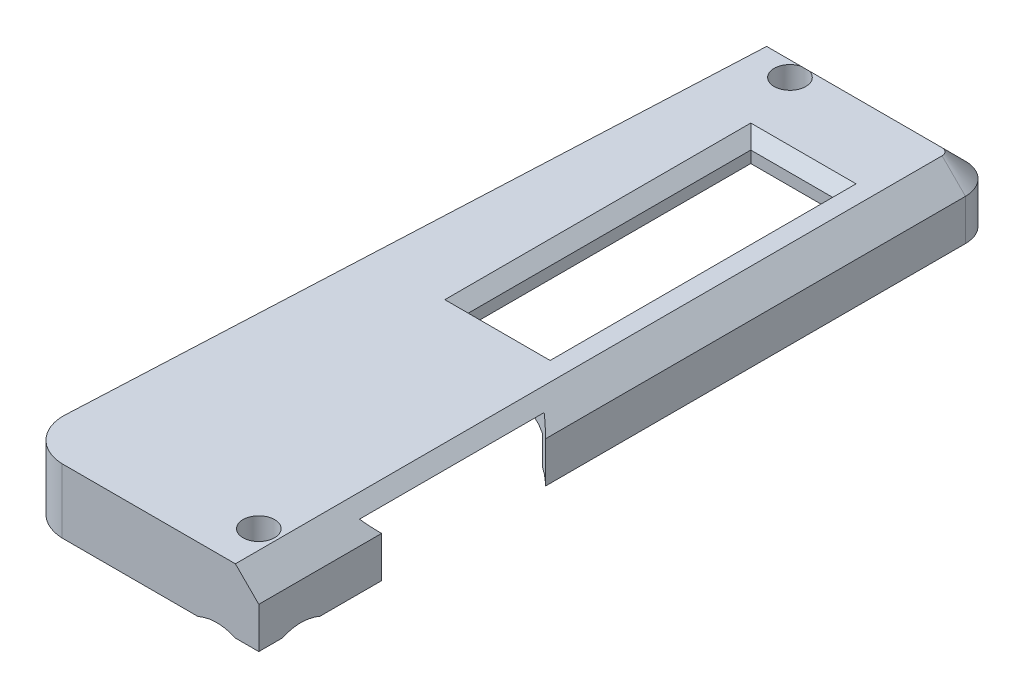
from build123d import *

# Parameters (mm, degrees)
SKETCH_1_R                      = 1.35
EXTRUDE_1_DEPTH                 = 2
EXTRUDE_2_DEPTH                 = 2
CUT_EXTRUDE_1_DEPTH             = 62.421331799
CUT_EXTRUDE_1_DEPTH_BACK        = 62.421331799
EXTRUDE_START                   = 3.5
EXTRUDE_3_DEPTH                 = 3.5
SKETCH_5_W                      = 14
SKETCH_5_H                      = 4.5
CUT_EXTRUDE_2_DEPTH             = 9
CUT_EXTRUDE_3_REACH             = 63.635
SKETCH_7_W                      = 7
SKETCH_7_H                      = 24
CUT_EXTRUDE_4_DEPTH             = 62.488454201
EXTRUDE_4_DEPTH                 = 3
EXTRUDE_START_2                 = 3
EXTRUDE_5_DEPTH                 = 3
CHAMFER_2_SIZE                  = 1.5
EXTRUDE_6_DEPTH                 = 1
EXTRUDE_START_3                 = 1
EXTRUDE_7_DEPTH                 = 1
CHAMFER_3_SIZE                  = 1.2
CUT_EXTRUDE_6_REACH             = 63.635
SKETCH_13_W                     = 7
SKETCH_13_H                     = 0.9
CUT_EXTRUDE_6_DIRECTION_2_DEPTH = 62.634649346
SKETCH_14_W                     = 7
SKETCH_14_H                     = 0.75
EXTRUDE_8_DEPTH                 = 2
CHAMFER_1_SIZE                  = 1
SKETCH_15_W                     = 2.625664416
SKETCH_15_H                     = 11
CUT_EXTRUDE_7_DEPTH             = 2.7
CUT_EXTRUDE_START               = -3
SKETCH_16_W                     = 0.55
SKETCH_16_H                     = 2.6
CUT_EXTRUDE_8_DEPTH             = 3
SKETCH_17_W                     = 0.7
SKETCH_17_H                     = 4
CUT_EXTRUDE_9_DEPTH             = 2
SKETCH_18_W                     = 2
SKETCH_18_H                     = 36.2
EXTRUDE_9_DEPTH                 = 2
EXTRUDE_START_4                 = 2
EXTRUDE_10_DEPTH                = 2
SKETCH_20_W                     = 4.68689843
SKETCH_20_H                     = 2
EXTRUDE_11_DEPTH                = 2
SKETCH_21_W                     = 1.738825119
SKETCH_21_H                     = 2
EXTRUDE_12_DEPTH                = 1
CUT_EXTRUDE_10_DEPTH            = 29.7
CHAMFER_4_SIZE                  = 2


with BuildPart() as part:
    # 草图1 → 凸台-拉伸1 (new body)
    with BuildSketch(Plane(origin=(0, 0, 0), x_dir=(1, 0, 0), z_dir=(0, 1, 0))):
        with BuildLine():
            Line((0, 3.3), (11.7, 3.3))
            ThreePointArc((11.7, 3.3), (13.538477631, 2.538477631), (14.3, 0.7))
            Line((14.3, 0.7), (14.3, -59.7))
            Line((14.3, -59.7), (-3.3, -59.7))
            Line((-3.3, -59.7), (-3.3, 0))
            Line((-3.3, 0), (-3.3, 3.3))
            Line((-3.3, 3.3), (0, 3.3))
        make_face()
        with Locations(Location((0, 0, 0), (0, 0, 270))):
            Circle(SKETCH_1_R, mode=Mode.SUBTRACT)
        with Locations(Location((10.7, -56.1, 0), (0, 0, 270))):
            Circle(SKETCH_1_R, mode=Mode.SUBTRACT)
    extrude(amount=EXTRUDE_1_DEPTH)

    # 草图2 → 凸台-拉伸2 (add)
    with BuildSketch(Plane(origin=(0, 2, 0), x_dir=(1, 0, 0), z_dir=(0, 1, 0))):
        Polygon((-3.3, 1.179910787), (-6.171573065, -59.7), (-3.3, -59.7), align=None)
    extrude(amount=-EXTRUDE_2_DEPTH)

    # 草图3 → 切除-拉伸1 (cut, two sides: drawn at the far end of the back side and taken through both)
    with BuildSketch(Plane(origin=(0, 2, 0), x_dir=(1, 0, 0), z_dir=(0, 1, 0)).offset(-CUT_EXTRUDE_1_DEPTH_BACK)):
        Polygon((-3.3, 3.3), (-3.3, 1.179910787), (-3.2, 3.3), align=None)
        with BuildLine():
            ThreePointArc((-2.499988961, -59.7), (-4.984483511, -58.608076588), (-6.001389, -56.091946))
            Line((-6.001389, -56.091946), (-6.171573065, -59.7))
            Line((-6.171573065, -59.7), (-2.499988961, -59.7))
        make_face()
    extrude(amount=CUT_EXTRUDE_1_DEPTH + CUT_EXTRUDE_1_DEPTH_BACK, mode=Mode.SUBTRACT)

    # 草图4 → 凸台-拉伸3 (add)
    with BuildSketch(Plane.XZ.offset(EXTRUDE_START)):
        with BuildLine():
            Line((-6.001389, 56.091946), (-3.2, -3.3))
            Line((-3.2, -3.3), (11.7, -3.3))
            ThreePointArc((11.7, -3.3), (13.538477631, -2.538477631), (14.3, -0.7))
            Line((14.3, -0.7), (14.3, 59.7))
            Line((14.3, 59.7), (-2.499988961, 59.7))
            ThreePointArc((-2.499988961, 59.7), (-4.984483511, 58.608076588), (-6.001389, 56.091946))
        make_face()
        with BuildLine():
            Line((12.8, -0.7), (12.8, 54.32447191))
            ThreePointArc((12.8, 54.32447191), (12.644543648, 58.044543648), (8.92447191, 58.2))
            Line((8.92447191, 58.2), (-2.476371899, 58.2))
            ThreePointArc((-2.476371899, 58.2), (-3.904150356, 57.567435732), (-4.501255338, 56.124468472))
            Line((-4.501255338, 56.124468472), (-1.945653662, 1.943433001))
            ThreePointArc((-1.945653662, 1.943433001), (-1.872904729, -2.013635488), (2.079062289, -1.8))
            Line((2.079062289, -1.8), (11.7, -1.8))
            ThreePointArc((11.7, -1.8), (12.477817459, -1.477817459), (12.8, -0.7))
        make_face(mode=Mode.SUBTRACT)
    extrude(amount=-EXTRUDE_3_DEPTH)

    # 草图5 → 切除-拉伸2 (cut)
    with BuildSketch(Plane(origin=(14.3, 0, 0), x_dir=(0, 0, -1), z_dir=(1, 0, 0))):
        with Locations((-42.2, -1.25)):
            Rectangle(SKETCH_5_W, SKETCH_5_H)
    extrude(amount=-CUT_EXTRUDE_2_DEPTH, mode=Mode.SUBTRACT)

    # 切除-拉伸3: up to this face of the body (flat: up to its plane)
    cut_extrude_3_end = Plane(part.part.faces().sort_by_distance((9.8, 1, 42.2))[0])
    # 草图6 → 切除-拉伸3 (cut, up to the picked face)
    with BuildSketch(Plane.XZ.offset(3.5), mode=Mode.PRIVATE) as cut_extrude_3_sk1:
        with BuildLine():
            Line((2.158571571, 33.539745962), (2.158571571, 50.860254038))
            ThreePointArc((2.158571571, 50.860254038), (17.158571571, 42.2), (2.158571571, 33.539745962))
        make_face()
    cut_extrude_3_tool1 = split(extrude(cut_extrude_3_sk1.sketch, amount=-CUT_EXTRUDE_3_REACH, mode=Mode.PRIVATE), bisect_by=cut_extrude_3_end, keep=Keep.BOTH, mode=Mode.PRIVATE)
    add(cut_extrude_3_tool1.solids().sort_by(Axis((8.87184, -3.5, 42.2), (0, 1, 0)))[0], mode=Mode.SUBTRACT)

    # 草图7 → 切除-拉伸4 (cut, through all)
    with BuildSketch(Plane.XZ):
        with Locations((6.2, 17.3)):
            Rectangle(SKETCH_7_W, SKETCH_7_H)
    extrude(amount=-CUT_EXTRUDE_4_DEPTH, mode=Mode.SUBTRACT)

    # 草图8 → 凸台-拉伸4 (add)
    with BuildSketch(Plane.XZ):
        Polygon((-2.891678333, 22), (0.3, 22), (0.3, 18), (-2.703007027, 18), align=None)
        Polygon((-2.514335721, 14), (0.3, 14), (0.3, 10), (-2.325664416, 10), align=None)
    extrude(amount=EXTRUDE_4_DEPTH)

    # 草图9 → 凸台-拉伸5 (add)
    with BuildSketch(Plane.XZ.offset(EXTRUDE_START_2)):
        with BuildLine():
            Line((2.75, 0), (2.75, 2.6))
            Line((2.75, 2.6), (3.3, 2.6))
            Line((3.3, 2.6), (3.3, -1.8))
            Line((3.3, -1.8), (2.079062289, -1.8))
            ThreePointArc((2.079062289, -1.8), (2.576812109, -0.960489122), (2.75, 0))
        make_face()
    extrude(amount=-EXTRUDE_5_DEPTH)

    # 倒角2
    chamfer_2_edges = [part.edges().sort_by_distance(p)[0] for p in [
        (0.3, -3, 20),
        (0.3, -3, 12),
        (3.025, -3, 2.6),
    ]]
    chamfer(chamfer_2_edges, length=CHAMFER_2_SIZE)

    # 草图10 → 凸台-拉伸6 (add)
    with BuildSketch(Plane.XZ):
        Polygon((0.3, 22), (0.3, 31.6), (-3.344489466, 31.6), (-2.891678333, 22), align=None)
        Polygon((0.3, 18), (0.3, 14), (-2.514335721, 14), (-2.703007027, 18), align=None)
    extrude(amount=EXTRUDE_6_DEPTH)

    # 草图11 → 凸台-拉伸7 (add)
    with BuildSketch(Plane.XZ.offset(EXTRUDE_START_3)):
        with BuildLine():
            Line((0.3, 31.6), (12.8, 31.6))
            Line((12.8, 31.6), (12.8, 33.943227914))
            ThreePointArc((12.8, 33.943227914), (7.537460775, 32.207180429), (2.158571571, 33.539745962))
            Line((2.158571571, 33.539745962), (2.158571571, 33.6))
            Line((2.158571571, 33.6), (-3.438825119, 33.6))
            Line((-3.438825119, 33.6), (-3.344489466, 31.6))
            Line((-3.344489466, 31.6), (0.3, 31.6))
        make_face()
    extrude(amount=-EXTRUDE_7_DEPTH)

    # 倒角3
    # the kernel refuses this chamfer: 1.2 mm, written as the material it takes off along each edge
    with BuildSketch(Plane(origin=(10.7, -3.5, 56.1), x_dir=(-0.25212926598993896, 0, -0.9676935637025672), z_dir=(-0.9676935637025672, 0, 0.25212926598993896))) as chamfer_3_piece_1:
        Polygon((2.75, -CHAMFER_3_SIZE), (2.75 + CHAMFER_3_SIZE, 0), (2.75, 0), align=None)
    revolve(axis=Axis((10.7, -3.5, 56.1), (0, -1, 0)), revolution_arc=299.20709405, mode=Mode.SUBTRACT)
    with BuildSketch(Plane(origin=(0, -3.5, 0), x_dir=(0.3317021922572173, 0, 0.9433841506256908), z_dir=(0.9433841506256908, 0, -0.3317021922572173))) as chamfer_3_piece_2_section:
        Polygon((2.75, -CHAMFER_3_SIZE), (2.75 + CHAMFER_3_SIZE, 0), (2.75, 0), align=None)
    chamfer_3_piece_2 = revolve(axis=Axis((0, -3.5, 0), (0, -1, 0)), revolution_arc=312.891771357, mode=Mode.PRIVATE)
    chamfer_3_piece_2 = split(chamfer_3_piece_2, bisect_by=Plane(origin=(2.75, -2.813189382, 1.829031727), z_dir=(-1, 0, 0)), keep=Keep.TOP, mode=Mode.PRIVATE)
    add(chamfer_3_piece_2, mode=Mode.SUBTRACT)
    with BuildSketch(Plane(origin=(0, -3.5, 0), x_dir=(0.3317021922572173, 0, 0.9433841506256908), z_dir=(0.9433841506256908, 0, -0.3317021922572173))) as chamfer_3_piece_3_section:
        Polygon((2.75, -CHAMFER_3_SIZE), (2.75 + CHAMFER_3_SIZE, 0), (2.75, 0), align=None)
    chamfer_3_piece_3 = revolve(axis=Axis((0, -3.5, 0), (0, -1, 0)), revolution_arc=312.891771357, mode=Mode.PRIVATE)
    chamfer_3_piece_3 = split(chamfer_3_piece_3, bisect_by=Plane(origin=(2.94239335, -3, -2.084958932), z_dir=(0, -1, 0)), keep=Keep.TOP, mode=Mode.PRIVATE)
    add(chamfer_3_piece_3, mode=Mode.SUBTRACT)

    # 草图13 → 切除-拉伸6 (cut, up to next)
    with BuildSketch(Plane(origin=(0, 2, 0), x_dir=(1, 0, 0), z_dir=(0, 1, 0)), mode=Mode.PRIVATE) as cut_extrude_6_sk1:
        with Locations((6.2, -29.75)):
            Rectangle(SKETCH_13_W, SKETCH_13_H)
    cut_extrude_6_tool1 = extrude(cut_extrude_6_sk1.sketch, amount=-CUT_EXTRUDE_6_REACH, mode=Mode.PRIVATE) & part.part
    add(cut_extrude_6_tool1.solids().sort_by_distance((6.2, 2, 29.75))[0], mode=Mode.SUBTRACT)

    # 草图13 → 切除-拉伸6 direction 2 (cut)
    with BuildSketch(Plane(origin=(0, 2, 0), x_dir=(1, 0, 0), z_dir=(0, 1, 0))):
        with Locations((6.2, -29.75)):
            Rectangle(SKETCH_13_W, SKETCH_13_H)
    extrude(amount=CUT_EXTRUDE_6_DIRECTION_2_DEPTH, mode=Mode.SUBTRACT)

    # 草图14 → 凸台-拉伸8 (add)
    with BuildSketch(Plane(origin=(0, 2, 0), x_dir=(1, 0, 0), z_dir=(0, 1, 0))):
        with Locations((6.2, -5.675)):
            Rectangle(SKETCH_14_W, SKETCH_14_H)
    extrude(amount=-EXTRUDE_8_DEPTH)

    # 倒角1
    chamfer_1_edges = [part.edges().sort_by_distance(p)[0] for p in [
        (2.7, 2, 18.125),
        (6.2, 2, 30.2),
        (9.7, 2, 18.125),
        (6.2, 2, 6.05),
    ]]
    chamfer(chamfer_1_edges, length=CHAMFER_1_SIZE)

    # 草图15 → 切除-拉伸7 (cut)
    with BuildSketch(Plane.XZ.offset(3)):
        with Locations((-1.012832208, 15.5)):
            Rectangle(SKETCH_15_W, SKETCH_15_H)
    extrude(amount=-CUT_EXTRUDE_7_DEPTH, mode=Mode.SUBTRACT)

    # 草图16 → 切除-拉伸8 (cut)
    with BuildSketch(Plane.XZ.offset(3).offset(CUT_EXTRUDE_START)):
        with Locations((3.025, 1.3)):
            Rectangle(SKETCH_16_W, SKETCH_16_H)
    extrude(amount=CUT_EXTRUDE_8_DEPTH, mode=Mode.SUBTRACT)

    # 草图17 → 切除-拉伸9 (cut)
    with BuildSketch(Plane.XZ.offset(3.5)):
        with Locations((13.15, 4.5)):
            Rectangle(SKETCH_17_W, SKETCH_17_H)
    extrude(amount=-CUT_EXTRUDE_9_DEPTH, mode=Mode.SUBTRACT)

    # 草图18 → 凸台-拉伸9 (add)
    with BuildSketch(Plane.XZ):
        with Locations((-0.7, 40.1)):
            Rectangle(SKETCH_18_W, SKETCH_18_H)
    extrude(amount=EXTRUDE_9_DEPTH)

    # 草图19 → 凸台-拉伸10 (add)
    with BuildSketch(Plane.XZ.offset(EXTRUDE_START_4)):
        with BuildLine():
            Line((9.357427842, 53.7), (0.3, 53.7))
            Line((0.3, 53.7), (0.3, 51.7))
            Line((0.3, 51.7), (4.036072572, 51.7))
            ThreePointArc((4.036072572, 51.7), (8.563084042, 52.100875957), (12.8, 50.456772086))
            Line((12.8, 50.456772086), (12.8, 54.32447191))
            ThreePointArc((12.8, 54.32447191), (11.190831463, 53.394157345), (9.357427842, 53.7))
        make_face()
    extrude(amount=-EXTRUDE_10_DEPTH)

    # 草图20 → 凸台-拉伸11 (add)
    with BuildSketch(Plane.XZ):
        with Locations((-2.043449215, 52.7)):
            Rectangle(SKETCH_20_W, SKETCH_20_H)
    extrude(amount=EXTRUDE_11_DEPTH)

    # 草图21 → 凸台-拉伸12 (add)
    with BuildSketch(Plane.XZ.offset(1)):
        with Locations((-2.569412559, 32.6)):
            Rectangle(SKETCH_21_W, SKETCH_21_H)
    extrude(amount=EXTRUDE_12_DEPTH)

    # 草图22 → 切除-拉伸10 (cut)
    with BuildSketch(Plane(origin=(0, 0, 22), x_dir=(-1, 0, 0), z_dir=(0, 0, -1))):
        Polygon((0.2, -2), (-0.3, -1.5), (-0.3, -2), align=None)
    extrude(amount=-CUT_EXTRUDE_10_DEPTH, mode=Mode.SUBTRACT)

    # 倒角4
    # the kernel refuses this chamfer: 2 mm, written as the material it takes off along each edge
    with BuildSketch(Plane(origin=(-8.343365976, 2, -3.3), x_dir=(0, 0.02749587661058627, 0.9996219169112968), z_dir=(1, 0, 0))) as chamfer_4_piece_1:
        Polygon((CHAMFER_4_SIZE * 0.999621916911, CHAMFER_4_SIZE * 0.0274958766106), (-CHAMFER_4_SIZE * 0.0274958766106, CHAMFER_4_SIZE * 0.999621916911), (0, 0), align=None)
    extrude(amount=20.043365976, mode=Mode.SUBTRACT)
    with BuildSketch(Plane(origin=(11.7, 2, -0.7), x_dir=(0, 0, -1), z_dir=(-1, 0, 0))) as chamfer_4_piece_2:
        Polygon((2.6 - CHAMFER_4_SIZE, 0), (2.6, CHAMFER_4_SIZE), (2.6, 0), align=None)
    revolve(axis=Axis((11.7, 2, -0.7), (0, -1, 0)), revolution_arc=90, mode=Mode.SUBTRACT)
    with BuildSketch(Plane(origin=(14.3, 2, -0.7), x_dir=(-0.9996219169112968, 0.02749587661058627, 0), z_dir=(0, 0, 1))) as chamfer_4_piece_3:
        Polygon((CHAMFER_4_SIZE * 0.999621916911, CHAMFER_4_SIZE * 0.0274958766106), (-CHAMFER_4_SIZE * 0.0274958766106, CHAMFER_4_SIZE * 0.999621916911), (0, 0), align=None)
    extrude(amount=65.543365976, mode=Mode.SUBTRACT)


solid = part.part
